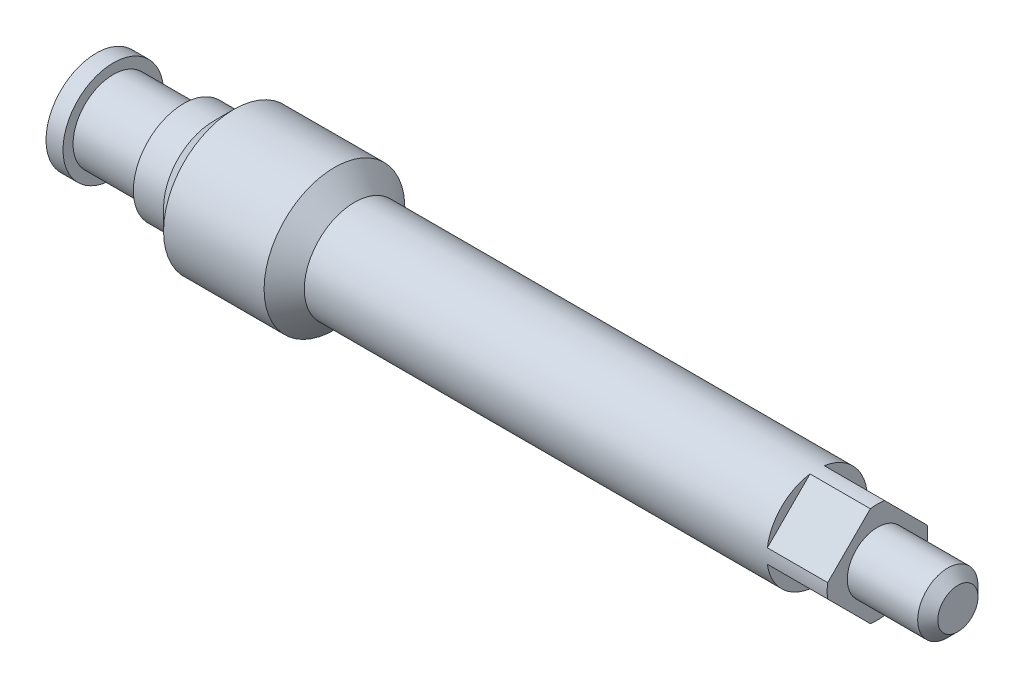
from build123d import *

# Parameters (mm, degrees)
CHAMFER1_SIZE      = 1
CHAMFER2_SIZE      = 2
SKETCH2_OUTSIDE_W  = 33.844
SKETCH2_OUTSIDE_H  = 33.844
CUT_EXTRUDE1_DEPTH = 6


with BuildPart() as part:
    # Sketch1 → Revolve1 (revolve)
    with BuildSketch(Plane.XY, mode=Mode.PRIVATE) as revolve1_sk:
        with BuildLine():
            Line((87, 0), (87, 3))
            Line((87, 3), (79, 3))
            Line((79, 3), (79, 5))
            Line((79, 5), (25, 5))
            Line((25, 5), (25, 7))
            Line((25, 7), (13, 7))
            Line((13, 7), (13, 5))
            Line((13, 5), (10, 5))
            Line((10, 5), (10, 4))
            Line((10, 4), (3, 4))
            Line((3, 4), (3, 5))
            Line((3, 5), (1.310723572, 5))
            ThreePointArc((1.310723572, 5), (0.382949383, 2.571411472), (0, 0))
            Line((0, 0), (87, 0))
        make_face()
    revolve(revolve1_sk.sketch.rotate(Axis((0, 0, 0), (1, 0, 0)), 90), axis=Axis((0, 0, 0), (1, 0, 0)))

    # Chamfer1
    chamfer1_edges = [part.edges().sort_by_distance(p)[0] for p in [
        (87, 0, -3),
    ]]
    chamfer(chamfer1_edges, length=CHAMFER1_SIZE)

    # Chamfer2
    chamfer2_edges = [part.edges().sort_by_distance(p)[0] for p in [
        (13, 0, -7),
        (25, 0, -5),
    ]]
    chamfer(chamfer2_edges, length=CHAMFER2_SIZE - 0.0001)  # a hair under: the kernel refuses the full size

    # Sketch2 outside → Cut-Extrude1 (cut)
    with BuildSketch(Plane(origin=(79, 0, 0), x_dir=(0, 0, -1), z_dir=(1, 0, 0))):
        Rectangle(SKETCH2_OUTSIDE_W, SKETCH2_OUTSIDE_H)
        Polygon((0, 5.656854249), (5.656854249, 0), (0, -5.656854249), (-5.656854249, 0), align=None, mode=Mode.SUBTRACT)
    extrude(amount=-CUT_EXTRUDE1_DEPTH, mode=Mode.SUBTRACT)


solid = part.part
